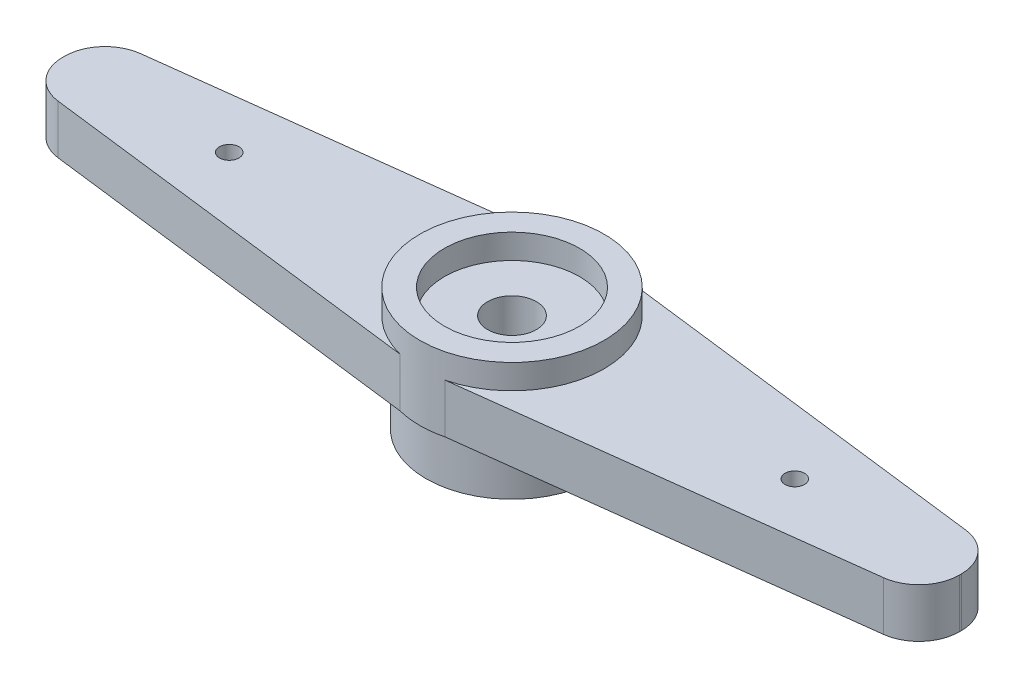
from build123d import *
from build123d.topology import SkipClean

# Parameters (mm, degrees)
SKETCH1_R           = 3.5
BOSS_EXTRUDE1_DEPTH = 5
SKETCH2_R           = 3
CUT_EXTRUDE1_DEPTH  = 4
SKETCH4_R           = 3.75
BOSS_EXTRUDE2_DEPTH = 2
SKETCH5_R           = 2.75
CUT_EXTRUDE2_DEPTH  = 1.8
SKETCH6_R           = 1.190625
CUT_EXTRUDE3_DEPTH  = 1.8
BOSS_EXTRUDE3_START = -1
BOSS_EXTRUDE3_DEPTH = 2
SKETCH9_R           = 0.9906
CUT_EXTRUDE4_DEPTH  = 20.055839
SKETCH10_R          = 0.396875
CUT_EXTRUDE5_DEPTH  = 20.055839


with BuildPart() as part:
    # Sketch1 → Boss-Extrude1 (new body)
    with BuildSketch(Plane(origin=(0, 0, 0), x_dir=(1, 0, 0), z_dir=(0, 1, 0))):
        Circle(SKETCH1_R)
    extrude(amount=BOSS_EXTRUDE1_DEPTH)

    # Sketch2 → Cut-Extrude1 (cut)
    with BuildSketch(Plane.XZ):
        Circle(SKETCH2_R)
    extrude(amount=-CUT_EXTRUDE1_DEPTH, mode=Mode.SUBTRACT)

    # Sketch4 → Boss-Extrude2 (add)
    with BuildSketch(Plane(origin=(0, 5, 0), x_dir=(1, 0, 0), z_dir=(0, 1, 0))):
        Circle(SKETCH4_R)
    extrude(amount=-BOSS_EXTRUDE2_DEPTH)

    # Sketch5 → Cut-Extrude2 (cut)
    with BuildSketch(Plane(origin=(0, 5, 0), x_dir=(1, 0, 0), z_dir=(0, 1, 0))):
        Circle(SKETCH5_R)
    extrude(amount=-CUT_EXTRUDE2_DEPTH, mode=Mode.SUBTRACT)

    # Sketch6 → Cut-Extrude3 (cut)
    with BuildSketch(Plane(origin=(0, 3.2, 0), x_dir=(1, 0, 0), z_dir=(0, 1, 0))):
        Circle(SKETCH6_R)
    extrude(amount=-CUT_EXTRUDE3_DEPTH, mode=Mode.SUBTRACT)

    # Sketch8 → Boss-Extrude3 (add)
    with SkipClean():  # the faces are left unmerged after this step: merging them gives an invalid solid
        with BuildSketch(Plane.XZ.offset(-3).offset(BOSS_EXTRUDE3_START)):
            with BuildLine():
                Line((0, 3.75), (-16.802200952, 1.675319737))
                ThreePointArc((-16.802200952, 1.675319737), (-17.83614958, 1.130657807), (-18.25, 0.037756066))
                Line((-18.25, 0.037756066), (-18.25, -0.037756066))
                ThreePointArc((-18.25, -0.037756066), (-17.83614958, -1.130657807), (-16.802200952, -1.675319737))
                Line((-16.802200952, -1.675319737), (0, -3.75))
                ThreePointArc((0, -3.75), (3.75, 0), (0, 3.75))
            make_face()
        boss_extrude3 = extrude(amount=BOSS_EXTRUDE3_DEPTH)
    add(part.part.scale(1), mode=Mode.REPLACE)  # the faces are merged on a copy

    # Mirror1: Boss-Extrude3 across plane
    add(boss_extrude3.mirror(Plane(origin=(0, 0, 0), x_dir=(0, 0, 1), z_dir=(1, 0, 0))))

    # Sketch9 → Cut-Extrude4 (cut, through all)
    with BuildSketch(Plane(origin=(0, 4, 0), x_dir=(1, 0, 0), z_dir=(0, 1, 0))):
        Circle(SKETCH9_R)
    extrude(amount=-CUT_EXTRUDE4_DEPTH, mode=Mode.SUBTRACT)

    # Sketch10 → Cut-Extrude5 (cut, through all)
    with BuildSketch(Plane(origin=(0, 4, 0), x_dir=(1, 0, 0), z_dir=(0, 1, 0))):
        with Locations((-11.509375, 0)):
            Circle(SKETCH10_R)
    cut_extrude5 = extrude(amount=-CUT_EXTRUDE5_DEPTH, mode=Mode.SUBTRACT)

    # Mirror2: Cut-Extrude5 across plane
    add(cut_extrude5.mirror(Plane(origin=(0, 0, 0), x_dir=(0, 0, 1), z_dir=(1, 0, 0))), mode=Mode.SUBTRACT)


solid = part.part
